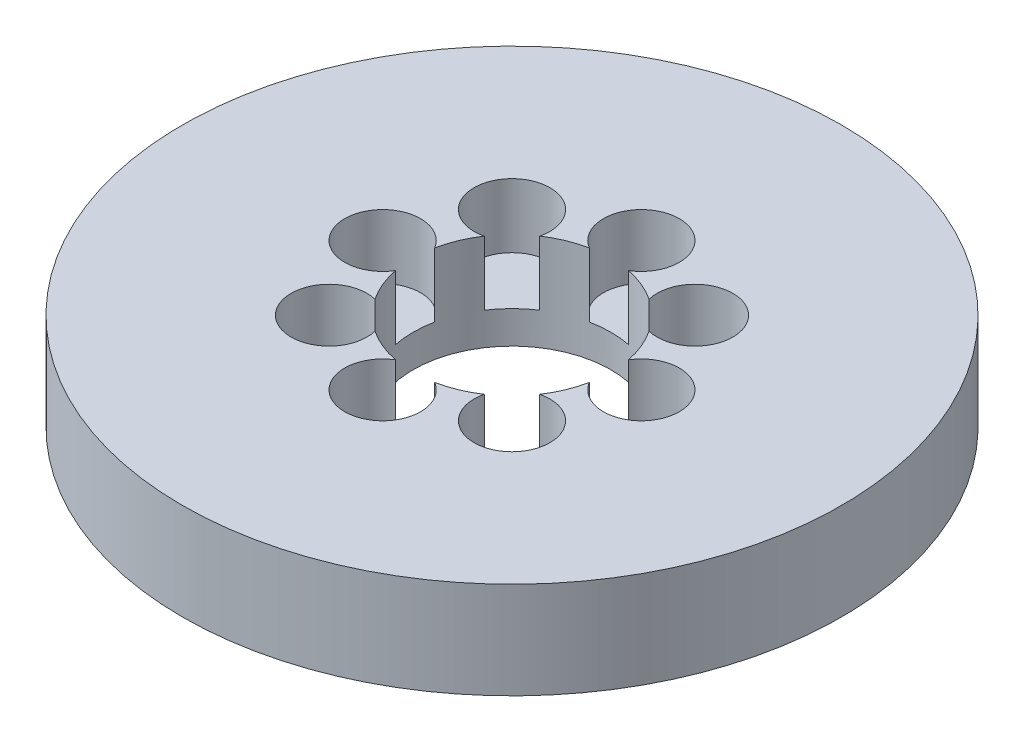
from build123d import *

# Parameters (mm, degrees)
SKETCH1_R           = 75
BOSS_EXTRUDE1_DEPTH = 22
SKETCH2_R           = 22.5
CUT_EXTRUDE1_DEPTH  = 109.323589305
SKETCH3_R           = 8.631575928
CUT_EXTRUDE2_DEPTH  = 14.601092561
CIRPATTERN1_COUNT   = 8


with BuildPart() as part:
    # Sketch1 → Boss-Extrude1 (new body)
    with BuildSketch(Plane(origin=(0, 0, 0), x_dir=(1, 0, 0), z_dir=(0, 1, 0))):
        Circle(SKETCH1_R)
    extrude(amount=BOSS_EXTRUDE1_DEPTH)

    # Sketch2 → Cut-Extrude1 (cut, through all)
    with BuildSketch(Plane(origin=(0, 0, 0), x_dir=(1, 0, 0), z_dir=(0, 1, 0))):
        Circle(SKETCH2_R)
    extrude(amount=CUT_EXTRUDE1_DEPTH, mode=Mode.SUBTRACT)

    # Sketch3 → Cut-Extrude2 (cut)
    with BuildSketch(Plane(origin=(0, 22, 0), x_dir=(1, 0, 0), z_dir=(0, 1, 0))):
        with Locations((-29.441869062, 0)):
            Circle(SKETCH3_R)
    cut_extrude2 = extrude(amount=-CUT_EXTRUDE2_DEPTH, mode=Mode.SUBTRACT)

    # CirPattern1: Cut-Extrude2 ×8 about axis
    cirpattern1_axis = Axis((0, 0, 0), (0, 1, 0))
    for i in range(1, CIRPATTERN1_COUNT):
        add(cut_extrude2.rotate(cirpattern1_axis, i * 360 / CIRPATTERN1_COUNT), mode=Mode.SUBTRACT)


solid = part.part
